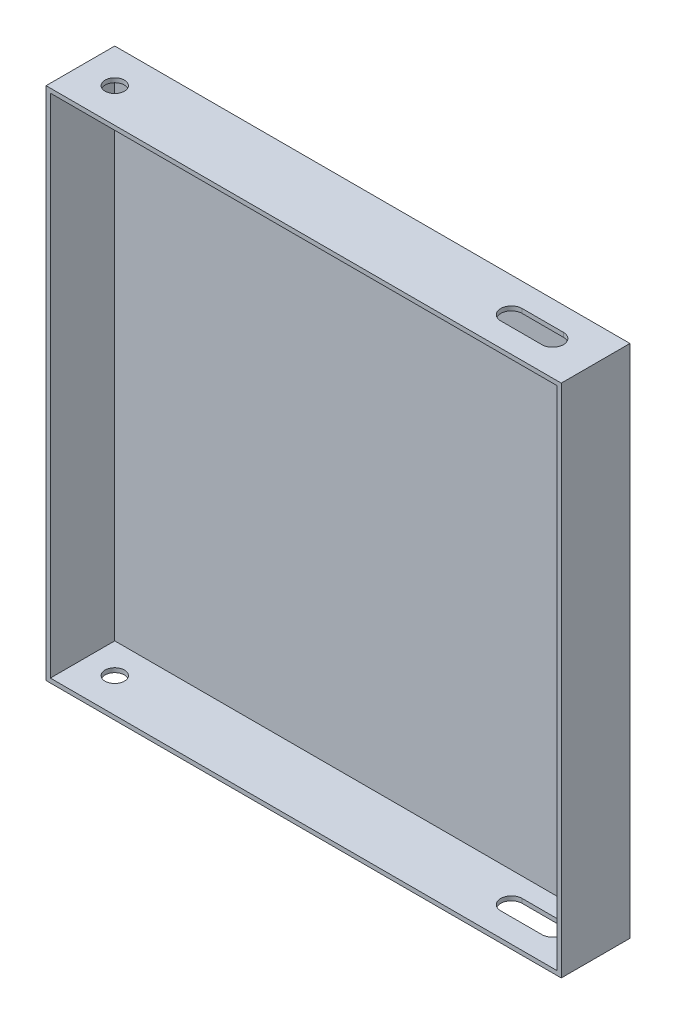
from build123d import *

# Parameters (mm, degrees)
SKETCH1_W           = 381
SKETCH1_H           = 381
BOSS_EXTRUDE1_DEPTH = 50.8
SHELL1_T            = -3.175
SKETCH2_R           = 7.14375
CUT_EXTRUDE1_DEPTH  = 417.576


with BuildPart() as part:
    # Sketch1 → Boss-Extrude1 (new body)
    with BuildSketch(Plane.XY):
        with Locations((190.5, 190.5)):
            Rectangle(SKETCH1_W, SKETCH1_H)
    extrude(amount=BOSS_EXTRUDE1_DEPTH)

    # Shell1
    shell1_openings = [part.faces().sort_by_distance(p)[0] for p in [
        (190.5, 190.5, 50.8),
    ]]
    offset(amount=SHELL1_T, openings=shell1_openings, kind=Kind.INTERSECTION)

    # Sketch2 → Cut-Extrude1 (cut)
    with BuildSketch(Plane(origin=(0, 381, 0), x_dir=(1, 0, 0), z_dir=(0, 1, 0))):
        with Locations((25.4, -25.4)):
            Circle(SKETCH2_R)
        with BuildLine():
            Line((349.25, -33.3375), (318.77, -33.3375))
            ThreePointArc((318.77, -33.3375), (310.8325, -25.4), (318.77, -17.4625))
            Line((318.77, -17.4625), (349.25, -17.4625))
            ThreePointArc((349.25, -17.4625), (357.1875, -25.4), (349.25, -33.3375))
        make_face()
    extrude(amount=-CUT_EXTRUDE1_DEPTH, mode=Mode.SUBTRACT)


solid = part.part
